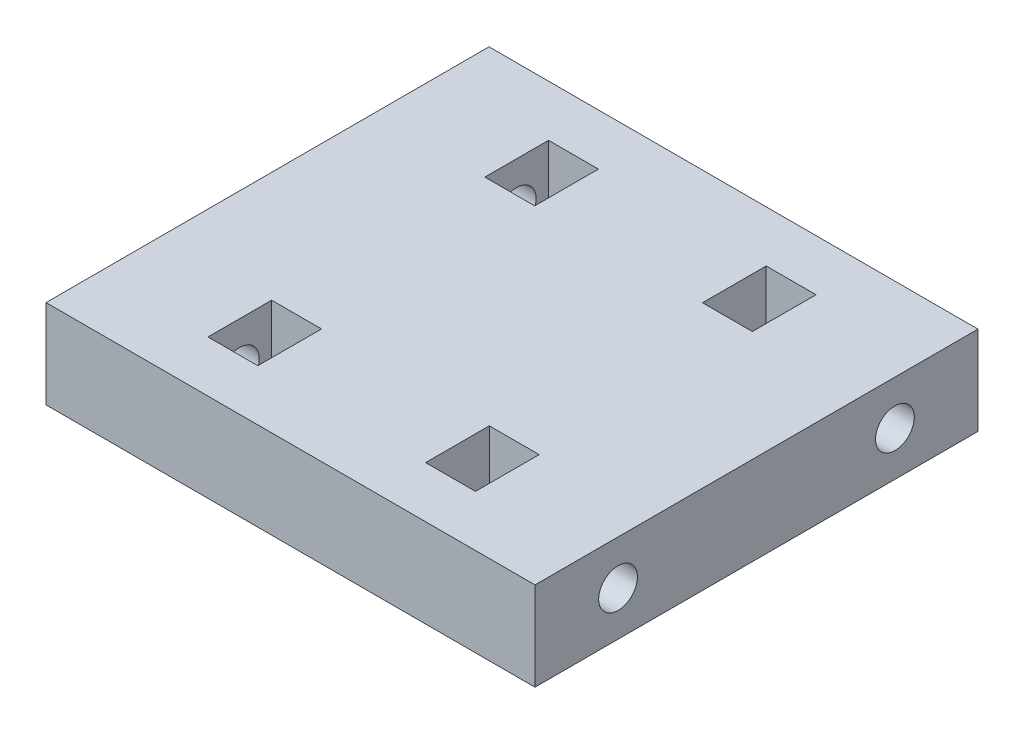
from build123d import *

# Parameters (mm, degrees)
SKETCH1_W           = 40
SKETCH1_H           = 8
BOSS_EXTRUDE1_DEPTH = 22.075
SKETCH2_R           = 1.75
CUT_EXTRUDE1_DEPTH  = 10
CUT_EXTRUDE2_DEPTH  = 4.5


with BuildPart() as part:
    # Sketch1 → Boss-Extrude1 (new, symmetric)
    with BuildSketch(Plane(origin=(0, 0, 0), x_dir=(0, 0, -1), z_dir=(1, 0, 0))):
        Rectangle(SKETCH1_W, SKETCH1_H)
    extrude(amount=BOSS_EXTRUDE1_DEPTH, both=True)

    # Sketch2 → Cut-Extrude1 (cut)
    with BuildSketch(Plane(origin=(22.075, 0, 0), x_dir=(0, 0, -1), z_dir=(1, 0, 0))):
        with Locations((-12.5, 0)):
            Circle(SKETCH2_R)
        with Locations((12.5, 0)):
            Circle(SKETCH2_R)
    cut_extrude1 = extrude(amount=-CUT_EXTRUDE1_DEPTH, mode=Mode.SUBTRACT)

    # Sketch3 → Cut-Extrude2 (cut)
    with BuildSketch(Plane(origin=(12.075, 0, 0), x_dir=(0, 0, -1), z_dir=(1, 0, 0))):
        Polygon((-15.375, 4), (-15.375, -1.659882024), (-12.5, -3.319764048), (-9.625, -1.659882024), (-9.625, 4), align=None)
        Polygon((15.375, 4), (9.625, 4), (9.625, -1.659882024), (12.5, -3.319764048), (15.375, -1.659882024), align=None)
    cut_extrude2 = extrude(amount=-CUT_EXTRUDE2_DEPTH, mode=Mode.SUBTRACT)

    # Mirror1: Cut-Extrude1, Cut-Extrude2 across plane
    add(cut_extrude1.mirror(Plane(origin=(0, 0, 0), x_dir=(0, 0, 1), z_dir=(1, 0, 0))), mode=Mode.SUBTRACT)
    add(cut_extrude2.mirror(Plane(origin=(0, 0, 0), x_dir=(0, 0, 1), z_dir=(1, 0, 0))), mode=Mode.SUBTRACT)


solid = part.part
